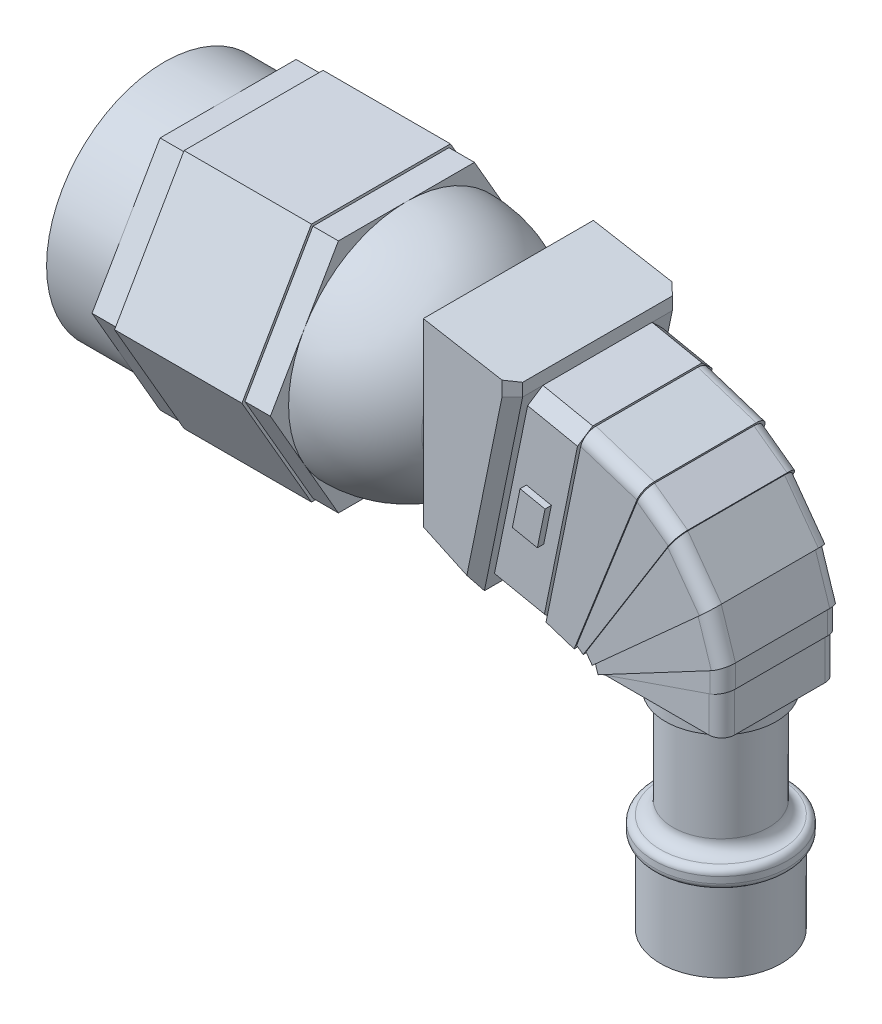
from build123d import *

# Parameters (mm, degrees)
SKETCH1_R                 = 9.25
BOSS_EXTRUDE1_DEPTH       = 5
BOSS_EXTRUDE2_DEPTH       = 14
BOSS_EXTRUDE3_DEPTH       = 5
BOSS_EXTRUDE3_DEPTH_BACK  = 5
BOSS_EXTRUDE3_START       = -7
REVOLVE1_ANGLE            = 180
BOSS_EXTRUDE4_START       = 8
SKETCH6_W                 = 13.351224976
SKETCH6_H                 = 12.806045122
BOSS_EXTRUDE4_DEPTH       = 4
DRAFT4_ANGLE              = 25
BOSS_EXTRUDE5_DEPTH       = 13.351224975
BOSS_EXTRUDE6_DEPTH       = 4
CHAMFER1_SIZE             = 0.8
BOSS_EXTRUDE7_DEPTH       = 0.5
BOSS_EXTRUDE8_DEPTH       = 5
BOSS_EXTRUDE8_DEPTH_BACK  = 5
BOSS_EXTRUDE9_DEPTH       = 4.9
BOSS_EXTRUDE9_DEPTH_BACK  = 4.9
BOSS_EXTRUDE10_DEPTH      = 4.8
BOSS_EXTRUDE10_DEPTH_BACK = 4.8
BOSS_EXTRUDE11_DEPTH      = 4.7
BOSS_EXTRUDE11_DEPTH_BACK = 4.7
BOSS_EXTRUDE12_DEPTH      = 4.6
BOSS_EXTRUDE12_DEPTH_BACK = 4.6
BOSS_EXTRUDE13_DEPTH      = 4.55
BOSS_EXTRUDE13_DEPTH_BACK = 4.55
FILLET1_R                 = 1
SKETCH16_R                = 4.35
BOSS_EXTRUDE14_DEPTH      = 1
SKETCH17_R                = 3.75
BOSS_EXTRUDE15_DEPTH      = 8.5
SKETCH18_R                = 5.25
BOSS_EXTRUDE16_DEPTH      = 1.5
SKETCH19_R                = 4.75
BOSS_EXTRUDE17_DEPTH      = 0.25
SKETCH21_R                = 4.75
BOSS_EXTRUDE18_DEPTH      = 6
SKETCH22_R                = 3.5
BOSS_EXTRUDE19_DEPTH      = 1
CHAMFER3_SIZE             = 0.25
FILLET2_R                 = 1
BOSS_EXTRUDE20_DEPTH      = 1
DRAFT8_ANGLE              = 10
FILLET3_R                 = 0.5
FILLET4_R                 = 0.5


# Some blends are built 0.0001 mm under size
with BuildPart() as part:
    # Sketch1 → Boss-Extrude1 (new body)
    with BuildSketch(Plane(origin=(0, 0, 0), x_dir=(0, 0, -1), z_dir=(1, 0, 0))):
        Circle(SKETCH1_R)
    extrude(amount=BOSS_EXTRUDE1_DEPTH)

    # Sketch2 → Boss-Extrude2 (add)
    with BuildSketch(Plane(origin=(5, 0, 0), x_dir=(0, 0, -1), z_dir=(1, 0, 0))):
        Polygon((5.34048999, -9.25), (10.68097998, 0), (5.34048999, 9.25), (-5.34048999, 9.25), (-10.68097998, 0), (-5.34048999, -9.25), align=None)
    extrude(amount=BOSS_EXTRUDE2_DEPTH)

    # Sketch3 → Boss-Extrude3 (add, two sides: drawn at the far end of the back side and taken through both)
    with BuildSketch(Plane(origin=(19, 0, 0), x_dir=(0, 0, -1), z_dir=(1, 0, 0)).offset(BOSS_EXTRUDE3_START - BOSS_EXTRUDE3_DEPTH_BACK)):
        Polygon((-5.455960044, -9.45), (5.455960044, -9.45), (10.911920088, 0), (5.455960044, 9.45), (-5.455960044, 9.45), (-10.911920088, 0), align=None)
    extrude(amount=BOSS_EXTRUDE3_DEPTH + BOSS_EXTRUDE3_DEPTH_BACK)

    # Sketch5 → Revolve1 (revolve)
    with BuildSketch(Plane(origin=(19, 0, 0), x_dir=(0, 0, -1), z_dir=(1, 0, 0))):
        with BuildLine():
            Line((0, 9.25), (0, -9.25))
            ThreePointArc((0, -9.25), (9.25, 0), (0, 9.25))
        make_face()
    revolve(axis=Axis((19, 9.25, 0), (0, -1, 0)), revolution_arc=REVOLVE1_ANGLE)

    # Sketch6 → Boss-Extrude4 (add)
    with BuildSketch(Plane(origin=(19, 0, 0), x_dir=(0, 0, -1), z_dir=(1, 0, 0)).offset(BOSS_EXTRUDE4_START)):
        Rectangle(SKETCH6_W, SKETCH6_H)
    extrude(amount=BOSS_EXTRUDE4_DEPTH)

    # Draft4
    draft4_faces = [part.faces().sort_by_distance(p)[0] for p in [
        (29, -6.403022561, 0),
    ]]
    draft(draft4_faces, Plane(origin=(27, 0, 0), x_dir=(0, 0, -1), z_dir=(-1, 0, 0)), DRAFT4_ANGLE)

    # Sketch7 → Boss-Extrude5 (add)
    with BuildSketch(Plane(origin=(0, 0, -6.675612488), x_dir=(-1, 0, 0), z_dir=(0, 0, -1))):
        Polygon((-31, 6.403022561), (-34, 6.403022561), (-31, -8.268253194), align=None)
    extrude(amount=-BOSS_EXTRUDE5_DEPTH)

    # Sketch8 → Boss-Extrude6 (add)
    with BuildSketch(Plane(origin=(31.378679406, -6.416349866, 0), x_dir=(0, 0, -1), z_dir=(0.979727290788127, -0.20033580729604167, 0))):
        Polygon((-4.28552155, 13.084633395), (-5.28552155, 12.084633395), (-5.28552155, -0.890223275), (-4.28552155, -1.890223275), (4.28552155, -1.890223275), (5.28552155, -0.890223275), (5.28552155, 12.084633395), (4.28552155, 13.084633395), align=None)
    extrude(amount=BOSS_EXTRUDE6_DEPTH)

    # Chamfer1
    chamfer1_edges = [part.edges().sort_by_distance(p)[0] for p in [
        (29, -7.335637877, 6.675612488),
        (32.5, -0.932615316, 6.675612487),
        (29, -7.335637877, -6.675612488),
        (32.5, -0.932615316, -6.675612488),
    ]]
    chamfer(chamfer1_edges, length=CHAMFER1_SIZE)

    # Sketch9 → Boss-Extrude7 (add)
    with BuildSketch(Plane.XY.offset(5.28552155)):
        Polygon((33.706800343, -0.022467337), (35.666254924, -0.423138952), (35.065247502, -3.362320824), (33.105792921, -2.961649209), align=None)
    boss_extrude7 = extrude(amount=BOSS_EXTRUDE7_DEPTH)

    # Mirror1: Boss-Extrude7 across plane
    add(boss_extrude7.mirror(Plane.XY))

    # Sketch10 → Boss-Extrude8 (add, two sides: drawn at the far end of the back side and taken through both)
    with BuildSketch(Plane.XY.offset(-BOSS_EXTRUDE8_DEPTH_BACK)):
        Polygon((37.883425978, 5.428151467), (42.457966503, 3.941793149), (37.166072101, -9.577617309), (34.961500136, -8.861308455), align=None)
    extrude(amount=BOSS_EXTRUDE8_DEPTH + BOSS_EXTRUDE8_DEPTH_BACK)

    # Sketch11 → Boss-Extrude9 (add, two sides: drawn at the far end of the back side and taken through both)
    with BuildSketch(Plane.XY.offset(-BOSS_EXTRUDE9_DEPTH_BACK)):
        Polygon((42.382713023, 3.749540128), (44.986256885, 1.857954789), (37.77853279, -9.707176208), (37.26219912, -9.332037838), align=None)
    extrude(amount=BOSS_EXTRUDE9_DEPTH + BOSS_EXTRUDE9_DEPTH_BACK)

    # Sketch12 → Boss-Extrude10 (add, two sides: drawn at the far end of the back side and taken through both)
    with BuildSketch(Plane.XY.offset(-BOSS_EXTRUDE10_DEPTH_BACK)):
        Polygon((37.900918056, -9.510803316), (44.893506769, 1.709132881), (47.543398175, -1.938129742), (38.389246582, -10.18292987), align=None)
    extrude(amount=BOSS_EXTRUDE10_DEPTH + BOSS_EXTRUDE10_DEPTH_BACK)

    # Sketch13 → Boss-Extrude11 (add, two sides: drawn at the far end of the back side and taken through both)
    with BuildSketch(Plane.XY.offset(-BOSS_EXTRUDE11_DEPTH_BACK)):
        Polygon((38.536099953, -10.050664561), (47.41569472, -2.053147442), (48.534236, -5.495663527), (38.745563718, -10.695327743), align=None)
    extrude(amount=BOSS_EXTRUDE11_DEPTH + BOSS_EXTRUDE11_DEPTH_BACK)

    # Sketch14 → Boss-Extrude12 (add, two sides: drawn at the far end of the back side and taken through both)
    with BuildSketch(Plane.XY.offset(-BOSS_EXTRUDE12_DEPTH_BACK)):
        Polygon((38.760033243, -10.687641647), (48.450638231, -5.540069991), (48.450638231, -7.355271794), align=None)
    extrude(amount=BOSS_EXTRUDE12_DEPTH + BOSS_EXTRUDE12_DEPTH_BACK)

    # Sketch15 → Boss-Extrude13 (add, two sides: drawn at the far end of the back side and taken through both)
    with BuildSketch(Plane.XY.offset(-BOSS_EXTRUDE13_DEPTH_BACK)):
        Polygon((48.308505546, -7.404147863), (39.061773044, -10.583880466), (48.308505546, -10.583880466), align=None)
    extrude(amount=BOSS_EXTRUDE13_DEPTH + BOSS_EXTRUDE13_DEPTH_BACK)

    # Fillet1
    # the kernel refuses this fillet: 1 mm, written as the material it takes off along each edge
    with BuildSketch(Plane(origin=(35.505784687, 6.200693953, -5), x_dir=(0, 0, 1), z_dir=(0.9510565162951532, -0.30901699437494873, 0))) as fillet1_piece_1_section:
        with BuildLine():
            CenterArc((FILLET1_R, FILLET1_R), FILLET1_R, 180, 90)
            Line((0, FILLET1_R), (-FILLET1_R * 0.02, FILLET1_R))
            Line((-FILLET1_R * 0.02, FILLET1_R), (-FILLET1_R * 0.02, -FILLET1_R * 0.02))
            Line((-FILLET1_R * 0.02, -FILLET1_R * 0.02), (FILLET1_R, -FILLET1_R * 0.02))
            Line((FILLET1_R, -FILLET1_R * 0.02), (FILLET1_R, 0))
        make_face()
    fillet1_piece_1 = extrude(amount=9.809956556, mode=Mode.PRIVATE)
    fillet1_piece_1 = split(fillet1_piece_1, bisect_by=Plane(origin=(37.784485844, 4.944292138, -4.77261539), z_dir=(0.9797272907881263, -0.20033580729604558, 0)), keep=Keep.TOP, mode=Mode.PRIVATE)
    fillet1_piece_1 = split(fillet1_piece_1, bisect_by=Plane(origin=(42.324693183, 3.601314564, -4.77261539), z_dir=(-0.9312032654638281, 0.36450031329136506, 0)), keep=Keep.TOP, mode=Mode.PRIVATE)
    add(fillet1_piece_1, mode=Mode.SUBTRACT)
    with BuildSketch(Plane(origin=(35.505784687, 6.200693953, 5), x_dir=(0, 0, -1), z_dir=(0.9510565162951532, -0.30901699437494873, 0))) as fillet1_piece_2_section:
        with BuildLine():
            CenterArc((FILLET1_R, -FILLET1_R), FILLET1_R, 90, 90)
            Line((0, -FILLET1_R), (-FILLET1_R * 0.02, -FILLET1_R))
            Line((-FILLET1_R * 0.02, -FILLET1_R), (-FILLET1_R * 0.02, FILLET1_R * 0.02))
            Line((-FILLET1_R * 0.02, FILLET1_R * 0.02), (FILLET1_R, FILLET1_R * 0.02))
            Line((FILLET1_R, FILLET1_R * 0.02), (FILLET1_R, 0))
        make_face()
    fillet1_piece_2 = extrude(amount=9.809956556, mode=Mode.PRIVATE)
    fillet1_piece_2 = split(fillet1_piece_2, bisect_by=Plane(origin=(37.784485844, 4.944292138, 4.77261539), z_dir=(0.9797272907881263, -0.20033580729604558, 0)), keep=Keep.TOP, mode=Mode.PRIVATE)
    fillet1_piece_2 = split(fillet1_piece_2, bisect_by=Plane(origin=(42.324693183, 3.601314564, 4.77261539), z_dir=(-0.9312032654638281, 0.36450031329136506, 0)), keep=Keep.TOP, mode=Mode.PRIVATE)
    add(fillet1_piece_2, mode=Mode.SUBTRACT)
    with BuildSketch(Plane(origin=(40.360170537, 5.219003259, -4.9), x_dir=(0, 0, 1), z_dir=(0.8090169943749466, -0.5877852522924746, 0))) as fillet1_piece_3_section:
        with BuildLine():
            CenterArc((FILLET1_R, FILLET1_R), FILLET1_R, 180, 90)
            Line((0, FILLET1_R), (-FILLET1_R * 0.02, FILLET1_R))
            Line((-FILLET1_R * 0.02, FILLET1_R), (-FILLET1_R * 0.02, -FILLET1_R * 0.02))
            Line((-FILLET1_R * 0.02, -FILLET1_R * 0.02), (FILLET1_R, -FILLET1_R * 0.02))
            Line((FILLET1_R, -FILLET1_R * 0.02), (FILLET1_R, 0))
        make_face()
    fillet1_piece_3 = extrude(amount=8.218157196, mode=Mode.PRIVATE)
    fillet1_piece_3 = split(fillet1_piece_3, bisect_by=Plane(origin=(42.152358132, 3.16104344, -4.671963642), z_dir=(0.9312032654638281, -0.36450031329136506, 0)), keep=Keep.TOP, mode=Mode.PRIVATE)
    fillet1_piece_3 = split(fillet1_piece_3, bisect_by=Plane(origin=(44.927257038, 1.76328677, -4.671963642), z_dir=(-0.8486731515694315, 0.5289176512513161, 0)), keep=Keep.TOP, mode=Mode.PRIVATE)
    add(fillet1_piece_3, mode=Mode.SUBTRACT)
    with BuildSketch(Plane(origin=(40.360170537, 5.219003259, 4.9), x_dir=(0, 0, -1), z_dir=(0.8090169943749466, -0.5877852522924746, 0))) as fillet1_piece_4_section:
        with BuildLine():
            CenterArc((FILLET1_R, -FILLET1_R), FILLET1_R, 90, 90)
            Line((0, -FILLET1_R), (-FILLET1_R * 0.02, -FILLET1_R))
            Line((-FILLET1_R * 0.02, -FILLET1_R), (-FILLET1_R * 0.02, FILLET1_R * 0.02))
            Line((-FILLET1_R * 0.02, FILLET1_R * 0.02), (FILLET1_R, FILLET1_R * 0.02))
            Line((FILLET1_R, FILLET1_R * 0.02), (FILLET1_R, 0))
        make_face()
    fillet1_piece_4 = extrude(amount=8.218157196, mode=Mode.PRIVATE)
    fillet1_piece_4 = split(fillet1_piece_4, bisect_by=Plane(origin=(42.152358132, 3.16104344, 4.671963642), z_dir=(0.9312032654638281, -0.36450031329136506, 0)), keep=Keep.TOP, mode=Mode.PRIVATE)
    fillet1_piece_4 = split(fillet1_piece_4, bisect_by=Plane(origin=(44.927257038, 1.76328677, 4.671963642), z_dir=(-0.8486731515694315, 0.5289176512513161, 0)), keep=Keep.TOP, mode=Mode.PRIVATE)
    add(fillet1_piece_4, mode=Mode.SUBTRACT)
    with BuildSketch(Plane(origin=(43.424043638, 3.731675367, -4.8), x_dir=(-0.8090169943749492, -0.5877852522924707, 0), z_dir=(0.5877852522924708, -0.8090169943749492, 0))) as fillet1_piece_5_section:
        with BuildLine():
            CenterArc((FILLET1_R, -FILLET1_R), FILLET1_R, 90, 90)
            Line((0, -FILLET1_R), (-FILLET1_R * 0.02, -FILLET1_R))
            Line((-FILLET1_R * 0.02, -FILLET1_R), (-FILLET1_R * 0.02, FILLET1_R * 0.02))
            Line((-FILLET1_R * 0.02, FILLET1_R * 0.02), (FILLET1_R, FILLET1_R * 0.02))
            Line((FILLET1_R, FILLET1_R * 0.02), (FILLET1_R, 0))
        make_face()
    fillet1_piece_5 = extrude(amount=9.508264534, mode=Mode.PRIVATE)
    fillet1_piece_5 = split(fillet1_piece_5, bisect_by=Plane(origin=(44.324817905, 0.796644956, -4.571748894), z_dir=(0.8486731515694315, -0.5289176512513161, 0)), keep=Keep.TOP, mode=Mode.PRIVATE)
    fillet1_piece_5 = split(fillet1_piece_5, bisect_by=Plane(origin=(47.549303394, -1.932811133, -4.571748894), z_dir=(-0.6692366176212915, 0.743049358814617, 0)), keep=Keep.TOP, mode=Mode.PRIVATE)
    add(fillet1_piece_5, mode=Mode.SUBTRACT)
    with BuildSketch(Plane(origin=(43.424043638, 3.731675367, 4.8), x_dir=(0, 0, -1), z_dir=(0.5877852522924708, -0.8090169943749492, 0))) as fillet1_piece_6_section:
        with BuildLine():
            CenterArc((FILLET1_R, -FILLET1_R), FILLET1_R, 90, 90)
            Line((0, -FILLET1_R), (-FILLET1_R * 0.02, -FILLET1_R))
            Line((-FILLET1_R * 0.02, -FILLET1_R), (-FILLET1_R * 0.02, FILLET1_R * 0.02))
            Line((-FILLET1_R * 0.02, FILLET1_R * 0.02), (FILLET1_R, FILLET1_R * 0.02))
            Line((FILLET1_R, FILLET1_R * 0.02), (FILLET1_R, 0))
        make_face()
    fillet1_piece_6 = extrude(amount=9.508264534, mode=Mode.PRIVATE)
    fillet1_piece_6 = split(fillet1_piece_6, bisect_by=Plane(origin=(44.324817905, 0.796644956, 4.571748894), z_dir=(0.8486731515694315, -0.5289176512513161, 0)), keep=Keep.TOP, mode=Mode.PRIVATE)
    fillet1_piece_6 = split(fillet1_piece_6, bisect_by=Plane(origin=(47.549303394, -1.932811133, 4.571748894), z_dir=(-0.6692366176212915, 0.743049358814617, 0)), keep=Keep.TOP, mode=Mode.PRIVATE)
    add(fillet1_piece_6, mode=Mode.SUBTRACT)
    with BuildSketch(Plane(origin=(46.643152234, 0.324493849, -4.7), x_dir=(-0.9510565162951539, -0.3090169943749468, 0), z_dir=(0.3090169943749468, -0.9510565162951538, 0))) as fillet1_piece_7_section:
        with BuildLine():
            CenterArc((FILLET1_R, -FILLET1_R), FILLET1_R, 90, 90)
            Line((0, -FILLET1_R), (-FILLET1_R * 0.02, -FILLET1_R))
            Line((-FILLET1_R * 0.02, -FILLET1_R), (-FILLET1_R * 0.02, FILLET1_R * 0.02))
            Line((-FILLET1_R * 0.02, FILLET1_R * 0.02), (FILLET1_R, FILLET1_R * 0.02))
            Line((FILLET1_R, FILLET1_R * 0.02), (FILLET1_R, 0))
        make_face()
    fillet1_piece_7 = extrude(amount=8.61967562, mode=Mode.PRIVATE)
    fillet1_piece_7 = split(fillet1_piece_7, bisect_by=Plane(origin=(46.696328069, -2.701053935, -4.471525659), z_dir=(0.6692366176212915, -0.743049358814617, 0)), keep=Keep.TOP, mode=Mode.PRIVATE)
    fillet1_piece_7 = split(fillet1_piece_7, bisect_by=Plane(origin=(48.606702009, -5.457170164, -4.471525659), z_dir=(-0.4691152643707939, 0.8831369478933152, 0)), keep=Keep.TOP, mode=Mode.PRIVATE)
    add(fillet1_piece_7, mode=Mode.SUBTRACT)
    with BuildSketch(Plane(origin=(46.643152234, 0.324493849, 4.7), x_dir=(0, 0, -1), z_dir=(0.3090169943749468, -0.9510565162951538, 0))) as fillet1_piece_8_section:
        with BuildLine():
            CenterArc((FILLET1_R, -FILLET1_R), FILLET1_R, 90, 90)
            Line((0, -FILLET1_R), (-FILLET1_R * 0.02, -FILLET1_R))
            Line((-FILLET1_R * 0.02, -FILLET1_R), (-FILLET1_R * 0.02, FILLET1_R * 0.02))
            Line((-FILLET1_R * 0.02, FILLET1_R * 0.02), (FILLET1_R, FILLET1_R * 0.02))
            Line((FILLET1_R, FILLET1_R * 0.02), (FILLET1_R, 0))
        make_face()
    fillet1_piece_8 = extrude(amount=8.61967562, mode=Mode.PRIVATE)
    fillet1_piece_8 = split(fillet1_piece_8, bisect_by=Plane(origin=(46.696328069, -2.701053935, 4.471525659), z_dir=(0.6692366176212915, -0.743049358814617, 0)), keep=Keep.TOP, mode=Mode.PRIVATE)
    fillet1_piece_8 = split(fillet1_piece_8, bisect_by=Plane(origin=(48.606702009, -5.457170164, 4.471525659), z_dir=(-0.4691152643707939, 0.8831369478933152, 0)), keep=Keep.TOP, mode=Mode.PRIVATE)
    add(fillet1_piece_8, mode=Mode.SUBTRACT)
    with BuildSketch(Plane(origin=(48.450638231, -3.040069991, -4.6), x_dir=(-1, 0, 0), z_dir=(0, -1, 0))) as fillet1_piece_9_section:
        with BuildLine():
            CenterArc((FILLET1_R, -FILLET1_R), FILLET1_R, 90, 90)
            Line((0, -FILLET1_R), (-FILLET1_R * 0.02, -FILLET1_R))
            Line((-FILLET1_R * 0.02, -FILLET1_R), (-FILLET1_R * 0.02, FILLET1_R * 0.02))
            Line((-FILLET1_R * 0.02, FILLET1_R * 0.02), (FILLET1_R, FILLET1_R * 0.02))
            Line((FILLET1_R, FILLET1_R * 0.02), (FILLET1_R, 0))
        make_face()
    fillet1_piece_9 = extrude(amount=6.815201803, mode=Mode.PRIVATE)
    fillet1_piece_9 = split(fillet1_piece_9, bisect_by=Plane(origin=(47.861735161, -5.85289058, -4.370703776), z_dir=(0.4691152643707939, -0.8831369478933152, 0)), keep=Keep.TOP, mode=Mode.PRIVATE)
    fillet1_piece_9 = split(fillet1_piece_9, bisect_by=Plane(origin=(48.501873721, -7.337653121, -4.370703776), z_dir=(-0.3251866210132924, 0.9456498620070525, 0)), keep=Keep.TOP, mode=Mode.PRIVATE)
    add(fillet1_piece_9, mode=Mode.SUBTRACT)
    with BuildSketch(Plane(origin=(48.450638231, -3.040069991, 4.6), x_dir=(0, 0, -1), z_dir=(0, -1, 0))) as fillet1_piece_10_section:
        with BuildLine():
            CenterArc((FILLET1_R, -FILLET1_R), FILLET1_R, 90, 90)
            Line((0, -FILLET1_R), (-FILLET1_R * 0.02, -FILLET1_R))
            Line((-FILLET1_R * 0.02, -FILLET1_R), (-FILLET1_R * 0.02, FILLET1_R * 0.02))
            Line((-FILLET1_R * 0.02, FILLET1_R * 0.02), (FILLET1_R, FILLET1_R * 0.02))
            Line((FILLET1_R, FILLET1_R * 0.02), (FILLET1_R, 0))
        make_face()
    fillet1_piece_10 = extrude(amount=6.815201803, mode=Mode.PRIVATE)
    fillet1_piece_10 = split(fillet1_piece_10, bisect_by=Plane(origin=(47.861735161, -5.85289058, 4.370703776), z_dir=(0.4691152643707939, -0.8831369478933152, 0)), keep=Keep.TOP, mode=Mode.PRIVATE)
    fillet1_piece_10 = split(fillet1_piece_10, bisect_by=Plane(origin=(48.501873721, -7.337653121, 4.370703776), z_dir=(-0.3251866210132924, 0.9456498620070525, 0)), keep=Keep.TOP, mode=Mode.PRIVATE)
    add(fillet1_piece_10, mode=Mode.SUBTRACT)
    with BuildSketch(Plane(origin=(48.308505546, -10.583880466, -4.55), x_dir=(-1, 0, 0), z_dir=(0, 1, 0))) as fillet1_piece_11_section:
        with BuildLine():
            CenterArc((FILLET1_R, FILLET1_R), FILLET1_R, 180, 90)
            Line((0, FILLET1_R), (-FILLET1_R * 0.02, FILLET1_R))
            Line((-FILLET1_R * 0.02, FILLET1_R), (-FILLET1_R * 0.02, -FILLET1_R * 0.02))
            Line((-FILLET1_R * 0.02, -FILLET1_R * 0.02), (FILLET1_R, -FILLET1_R * 0.02))
            Line((FILLET1_R, -FILLET1_R * 0.02), (FILLET1_R, 0))
        make_face()
    fillet1_piece_11 = extrude(amount=5.679732603, mode=Mode.PRIVATE)
    fillet1_piece_11 = split(fillet1_piece_11, bisect_by=Plane(origin=(47.610056609, -7.644327933, -4.320561018), z_dir=(0.3251866210132924, -0.9456498620070525, 0)), keep=Keep.TOP, mode=Mode.PRIVATE)
    add(fillet1_piece_11, mode=Mode.SUBTRACT)
    with BuildSketch(Plane(origin=(48.308505546, -10.583880466, 4.55), x_dir=(-1, 0, 0), z_dir=(0, 1, 0))) as fillet1_piece_12_section:
        with BuildLine():
            CenterArc((FILLET1_R, -FILLET1_R), FILLET1_R, 90, 90)
            Line((0, -FILLET1_R), (-FILLET1_R * 0.02, -FILLET1_R))
            Line((-FILLET1_R * 0.02, -FILLET1_R), (-FILLET1_R * 0.02, FILLET1_R * 0.02))
            Line((-FILLET1_R * 0.02, FILLET1_R * 0.02), (FILLET1_R, FILLET1_R * 0.02))
            Line((FILLET1_R, FILLET1_R * 0.02), (FILLET1_R, 0))
        make_face()
    fillet1_piece_12 = extrude(amount=5.679732603, mode=Mode.PRIVATE)
    fillet1_piece_12 = split(fillet1_piece_12, bisect_by=Plane(origin=(47.610056609, -7.644327933, 4.320561018), z_dir=(0.3251866210132924, -0.9456498620070525, 0)), keep=Keep.TOP, mode=Mode.PRIVATE)
    add(fillet1_piece_12, mode=Mode.SUBTRACT)

    # Sketch16 → Boss-Extrude14 (add)
    with BuildSketch(Plane.XZ.offset(10.583880466)):
        with Locations(Location((43.685139295, 0, 0), (0, 0, 270))):
            Circle(SKETCH16_R)
    extrude(amount=BOSS_EXTRUDE14_DEPTH)

    # Sketch17 → Boss-Extrude15 (add)
    with BuildSketch(Plane.XZ.offset(11.583880466)):
        with Locations(Location((43.685139295, 0, 0), (0, 0, 270))):
            Circle(SKETCH17_R)
    extrude(amount=BOSS_EXTRUDE15_DEPTH)

    # Sketch18 → Boss-Extrude16 (add)
    with BuildSketch(Plane.XZ.offset(20.083880466)):
        with Locations(Location((43.685139295, 0, 0), (0, 0, 270))):
            Circle(SKETCH18_R)
    extrude(amount=BOSS_EXTRUDE16_DEPTH)

    # Sketch19 → Boss-Extrude17 (add)
    with BuildSketch(Plane.XZ.offset(21.583880466)):
        with Locations(Location((43.685139295, 0, 0), (0, 0, 270))):
            Circle(SKETCH19_R)
    extrude(amount=BOSS_EXTRUDE17_DEPTH)

    # Sketch21 → Boss-Extrude18 (add)
    with BuildSketch(Plane.XZ.offset(21.833880466)):
        with Locations(Location((43.685139295, 0, 0), (0, 0, 270))):
            Circle(SKETCH21_R)
    extrude(amount=BOSS_EXTRUDE18_DEPTH)

    # Sketch22 → Boss-Extrude19 (add)
    with BuildSketch(Plane.XZ.offset(27.833880466)):
        with Locations(Location((43.685139295, 0, 0), (0, 0, 270))):
            Circle(SKETCH22_R)
    extrude(amount=BOSS_EXTRUDE19_DEPTH)

    # Chamfer3
    chamfer3_edges = [part.edges().sort_by_distance(p)[0] for p in [
        (43.685139295, -28.833880466, 3.5),
    ]]
    chamfer(chamfer3_edges, length=CHAMFER3_SIZE)

    # Fillet2
    fillet2_edges = [part.edges().sort_by_distance(p)[0] for p in [
        (43.685139295, -20.083880466, 3.75),
    ]]
    fillet(fillet2_edges, radius=FILLET2_R)

    # Sketch23 → Boss-Extrude20 (add)
    with BuildSketch(Plane(origin=(0, 6.403022561, 0), x_dir=(1, 0, 0), z_dir=(0, 1, 0))):
        Polygon((27, -6.675612488), (33.183446243, -6.675612488), (34, -5.875612488), (34, -4.28552155), (34, 4.28552155), (34, 5.875612488), (33.183446243, 6.675612488), (27, 6.675612488), align=None)
    extrude(amount=BOSS_EXTRUDE20_DEPTH)

    # Draft8
    draft8_faces = [part.faces().sort_by_distance(p)[0] for p in [
        (30.477279885, 7.403022561, 0),
    ]]
    draft(draft8_faces, Plane(origin=(34, 7.403022561, -4.28552155), x_dir=(0, 0, 1), z_dir=(1, 0, 0)), DRAFT8_ANGLE)

    # Fillet3
    fillet3_edges = [part.edges().sort_by_distance(p)[0] for p in [
        (27, 0, 4.643543905),
    ]]
    fillet(fillet3_edges, radius=FILLET3_R)

    # Fillet4
    fillet4_edges = [part.edges().sort_by_distance(p)[0] for p in [
        (43.685139295, -20.083880466, 5.25),
        (43.685139295, -21.583880466, 5.25),
    ]]
    fillet(fillet4_edges, radius=FILLET4_R - 0.0001)  # a hair under: the kernel refuses the full size


solid = part.part
